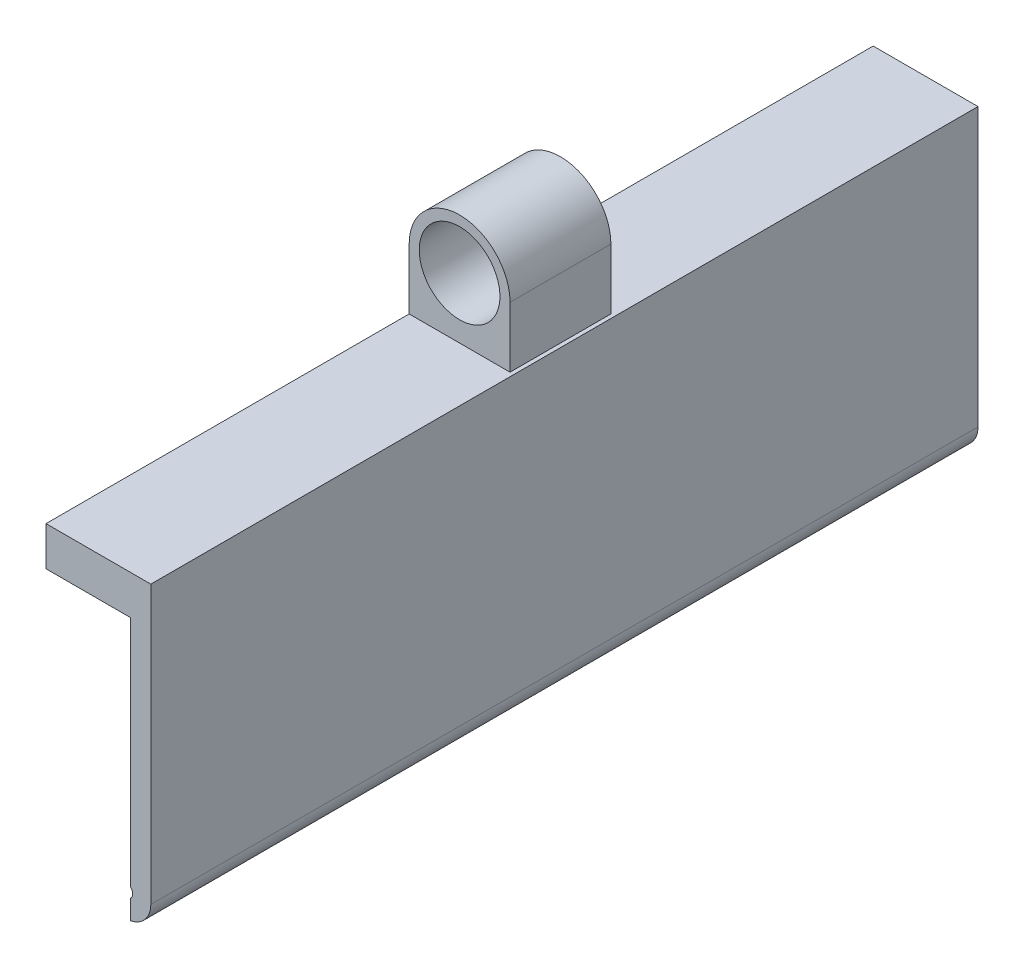
from build123d import *

# Parameters (mm, degrees)
SKETCH1_R           = 0.64
BOSS_EXTRUDE1_DEPTH = 82
SKETCH3_W           = 2
SKETCH3_H           = 82
BOSS_EXTRUDE4_DEPTH = 2.5
SKETCH6_W           = 82
SKETCH6_H           = 3.880734095
BOSS_EXTRUDE5_DEPTH = 8.39
BOSS_EXTRUDE6_START = -36
SKETCH8_R           = 4
BOSS_EXTRUDE6_DEPTH = 10
CUT_EXTRUDE1_START  = -10
SKETCH9_W           = 5
SKETCH9_H           = 7.591688675
CUT_EXTRUDE1_DEPTH  = 62
SKETCH9_2_W         = 5
SKETCH9_2_H         = 7.591688675
CUT_EXTRUDE2_DEPTH  = 5
CUT_EXTRUDE3_START  = -77
SKETCH9_3_W         = 5
SKETCH9_3_H         = 7.591688675
CUT_EXTRUDE3_DEPTH  = 5


with BuildPart() as part:
    # Sketch1 → Boss-Extrude1 (new body)
    with BuildSketch(Plane.XY):
        with BuildLine():
            Line((2.44, 0), (2.44, 25))
            Line((2.44, 25), (0.44, 25))
            Line((0.44, 25), (0.44, 4.489988864))
            ThreePointArc((0.44, 4.489988864), (0.044314057, 3.140225052), (-1.017489879, 2.217727293))
            ThreePointArc((-1.017489879, 2.217727293), (-1.317369481, -2.05381052), (2.44, 0))
        make_face()
        Circle(SKETCH1_R, mode=Mode.SUBTRACT)
    extrude(amount=BOSS_EXTRUDE1_DEPTH)

    # Sketch3 → Boss-Extrude4 (add)
    with BuildSketch(Plane(origin=(0, 25, 0), x_dir=(1, 0, 0), z_dir=(0, 1, 0))):
        with Locations((1.44, -41)):
            Rectangle(SKETCH3_W, SKETCH3_H)
    extrude(amount=BOSS_EXTRUDE4_DEPTH)

    # Sketch6 → Boss-Extrude5 (add)
    with BuildSketch(Plane.ZY.offset(-0.44)):
        with Locations((41, 25.559632953)):
            Rectangle(SKETCH6_W, SKETCH6_H)
    extrude(amount=BOSS_EXTRUDE5_DEPTH)

    # Sketch8 → Boss-Extrude6 (add)
    with BuildSketch(Plane(origin=(0, 0, 0), x_dir=(-1, 0, 0), z_dir=(0, 0, -1)).offset(BOSS_EXTRUDE6_START)):
        with BuildLine():
            Line((7.95, 27.5), (7.95, 33.5))
            ThreePointArc((7.95, 33.5), (2.95, 38.5), (-2.05, 33.5))
            Line((-2.05, 33.5), (-2.05, 27.5))
            Line((-2.05, 27.5), (7.95, 27.5))
        make_face()
        with Locations((2.95, 33.5)):
            Circle(SKETCH8_R, mode=Mode.SUBTRACT)
    extrude(amount=-BOSS_EXTRUDE6_DEPTH)

    # Sketch9 → Cut-Extrude1 (cut)
    with BuildSketch(Plane(origin=(0, 0, 0), x_dir=(-1, 0, 0), z_dir=(0, 0, -1)).offset(CUT_EXTRUDE1_START)):
        with Locations((2.06, 1.355844337)):
            Rectangle(SKETCH9_W, SKETCH9_H)
    extrude(amount=-CUT_EXTRUDE1_DEPTH, mode=Mode.SUBTRACT)

    # Sketch9<2> → Cut-Extrude2 (cut)
    with BuildSketch(Plane(origin=(0, 0, 0), x_dir=(-1, 0, 0), z_dir=(0, 0, -1))):
        with Locations((2.06, 1.355844337)):
            Rectangle(SKETCH9_2_W, SKETCH9_2_H)
    extrude(amount=-CUT_EXTRUDE2_DEPTH, mode=Mode.SUBTRACT)

    # Sketch9<3> → Cut-Extrude3 (cut)
    with BuildSketch(Plane(origin=(0, 0, 0), x_dir=(-1, 0, 0), z_dir=(0, 0, -1)).offset(CUT_EXTRUDE3_START)):
        with Locations((2.06, 1.355844337)):
            Rectangle(SKETCH9_3_W, SKETCH9_3_H)
    extrude(amount=-CUT_EXTRUDE3_DEPTH, mode=Mode.SUBTRACT)


solid = part.part
